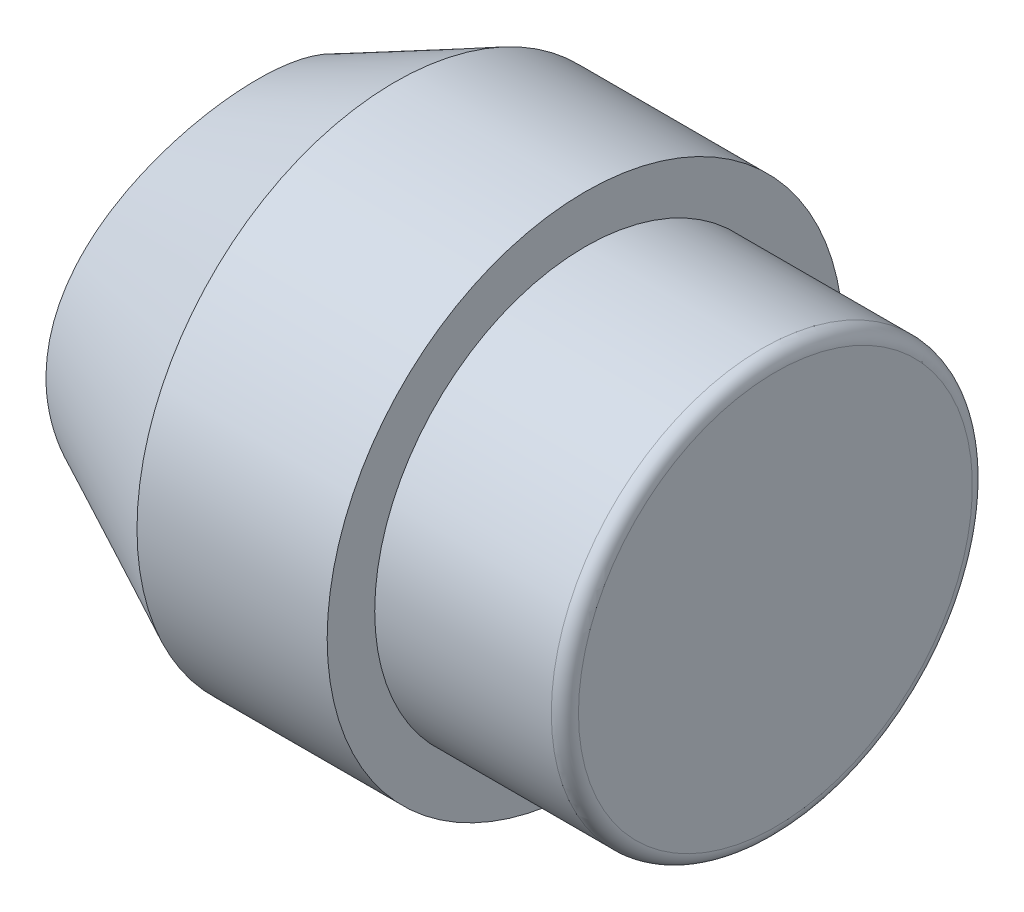
from build123d import *

# Parameters (mm, degrees)
CUT_EXTRUDE1_DEPTH      = 32.163141952
CUT_EXTRUDE1_DEPTH_BACK = 32.163141952
FILLET1_R               = 0.5


# Read off the part's stored shape, not the designer's step: Revolve2
with BuildPart() as part:
    # Revolve2 outline → Revolve2 (revolve)
    with BuildSketch(Plane.YX):
        Polygon((7.75, 28.118346614), (0, 28.118346614), (0, 7.618346614), (6.35, 7.618346614), (9.5, 14.118346614), (9.5, 21.118346614), (7.75, 21.118346614), align=None)
    revolve(axis=Axis((0, 0, 0), (1, 0, 0)))

    # Sketch3 → Cut-Extrude1 (cut, two sides: drawn at the far end of the back side and taken through both)
    with BuildSketch(Plane(origin=(0, 0, 0), x_dir=(1, 0, 0), z_dir=(0, 1, 0)).offset(-CUT_EXTRUDE1_DEPTH_BACK)):
        with BuildLine():
            Line((7.618346614, 6.35), (7.618346614, -6.35))
            ThreePointArc((7.618346614, -6.35), (9.046260231, 0), (7.618346614, 6.35))
        make_face()
    extrude(amount=CUT_EXTRUDE1_DEPTH + CUT_EXTRUDE1_DEPTH_BACK, mode=Mode.SUBTRACT)

    # Fillet1
    fillet1_edges = [part.edges().sort_by_distance(p)[0] for p in [
        (28.118346614, -7.75, 0),
    ]]
    fillet(fillet1_edges, radius=FILLET1_R)


solid = part.part
